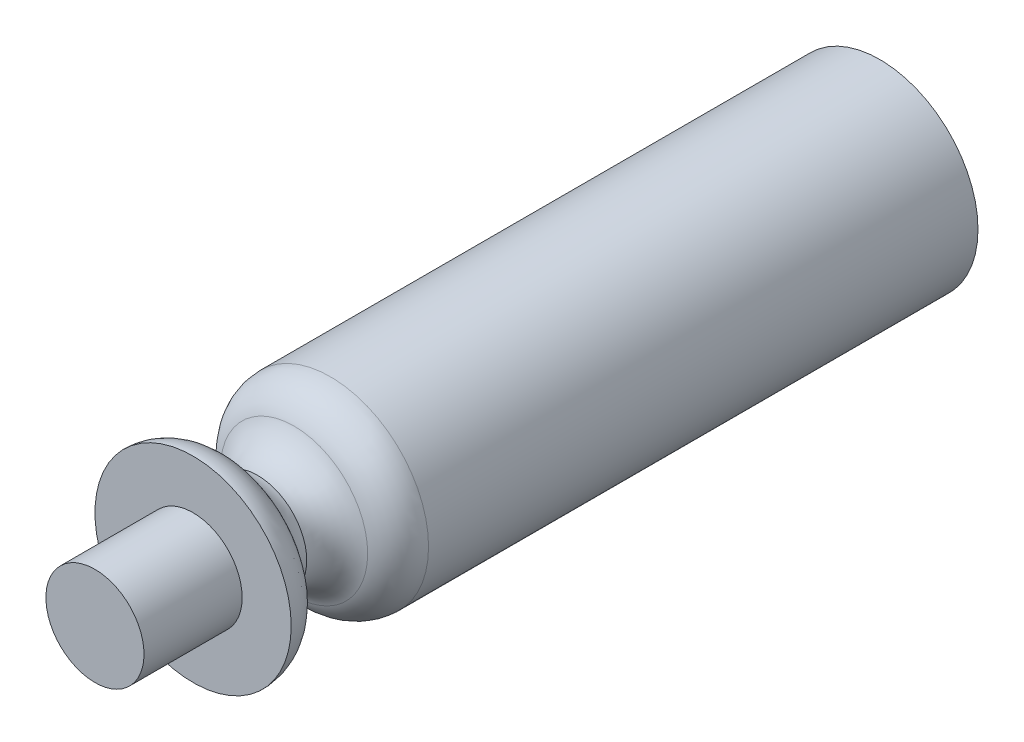
from build123d import *

# Parameters (mm, degrees)
SKETCH_1_R          = 5
EXTRUDE_1_DEPTH     = 40
CUT_EXTRUDE_1_DEPTH = 7
SKETCH_4_R          = 6.5
SKETCH_4_R_2        = 2.5
CUT_EXTRUDE_4_DEPTH = 10
EXTRUDE_START       = -7
SKETCH_7_R          = 5
EXTRUDE_2_DEPTH     = 7
SKETCH_10_R         = 6.5
SKETCH_10_R_2       = 2.5
CUT_EXTRUDE_5_DEPTH = 5
FILLET_3_R          = 2
FILLET_4_R          = 2
FILLET_5_R          = 2


with BuildPart() as part:
    # Эскиз1 → Бобышка-Вытянуть1 (new body)
    with BuildSketch(Plane.XY):
        Circle(SKETCH_1_R)
    extrude(amount=EXTRUDE_1_DEPTH)

    # Эскиз3 → Вырез-Вытянуть1 (cut)
    with BuildSketch(Plane(origin=(0, 0, 0), x_dir=(-1, 0, 0), z_dir=(0, 0, -1))):
        with BuildLine():
            Line((-2.2, -2.323790008), (-2.2, 2.323790008))
            ThreePointArc((-2.2, 2.323790008), (0, 3.2), (2.2, 2.323790008))
            Line((2.2, 2.323790008), (2.2, -2.323790008))
            ThreePointArc((2.2, -2.323790008), (0, -3.2), (-2.2, -2.323790008))
        make_face()
    extrude(amount=-CUT_EXTRUDE_1_DEPTH, mode=Mode.SUBTRACT)

    # Эскиз4 → Вырез-Вытянуть-Тонкостенный4 (cut)
    with BuildSketch(Plane.XY.offset(40)):
        Circle(SKETCH_4_R)
        Circle(SKETCH_4_R_2, mode=Mode.SUBTRACT)
    extrude(amount=-CUT_EXTRUDE_4_DEPTH, mode=Mode.SUBTRACT)

    # Эскиз7 → Бобышка-Вытянуть2 (add)
    with BuildSketch(Plane.XY.offset(40).offset(EXTRUDE_START)):
        Circle(SKETCH_7_R)
    extrude(amount=EXTRUDE_2_DEPTH)

    # Эскиз10 → Вырез-Вытянуть-Тонкостенный5 (cut)
    with BuildSketch(Plane.XY.offset(40)):
        Circle(SKETCH_10_R)
        Circle(SKETCH_10_R_2, mode=Mode.SUBTRACT)
    extrude(amount=-CUT_EXTRUDE_5_DEPTH, mode=Mode.SUBTRACT)

    # Скругление3
    fillet_3_edges = [part.edges().sort_by_distance(p)[0] for p in [
        (-5, 0, 30),
    ]]
    fillet(fillet_3_edges, radius=FILLET_3_R)

    # Скругление4
    fillet_4_edges = [part.edges().sort_by_distance(p)[0] for p in [
        (-5, 0, 33),
    ]]
    fillet(fillet_4_edges, radius=FILLET_4_R - 0.0001)  # a hair under: the kernel refuses the full size

    # Скругление5
    fillet_5_edges = [part.edges().sort_by_distance(p)[0] for p in [
        (-2.5, 0, 30),
    ]]
    fillet(fillet_5_edges, radius=FILLET_5_R)

    # Скругление6: read off the stored shape, not the designer's step
    # Скругление6 outline → Скругление6 (revolve)
    with BuildSketch(Plane.XZ):
        with BuildLine():
            Line((3.726034838, 33.136435294), (3, 33.136435294))
            Line((3, 33.136435294), (3, 33))
            Line((3, 33), (2.5, 33))
            Line((2.5, 33), (2.5, 31.708099244))
            ThreePointArc((2.5, 31.708099244), (2.934473908, 32.575522915), (3.726034838, 33.136435294))
        make_face()
    revolve(axis=Axis((0, 0, 0), (0, 0, 1)))


solid = part.part
